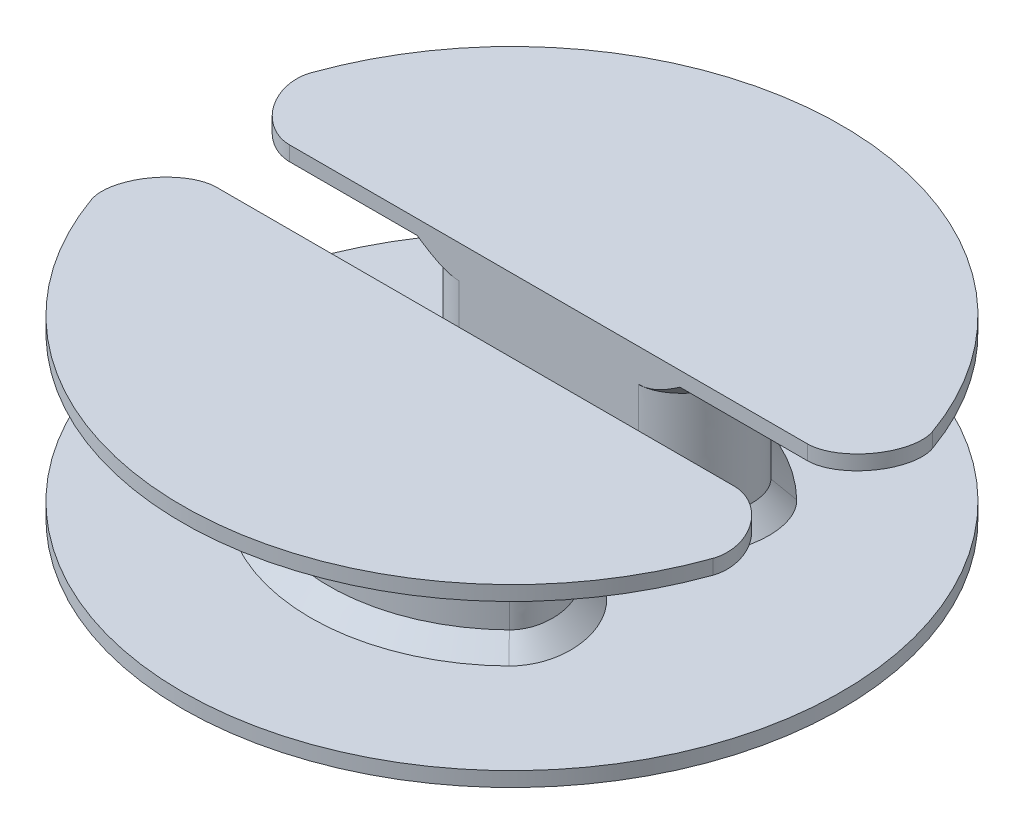
from build123d import *

# Parameters (mm, degrees)
BOSS_EXTRUDE1_DEPTH = 40
BOSS_EXTRUDE5_START = 40
BOSS_EXTRUDE5_DEPTH = 4
BOSS_EXTRUDE6_START = -4
SKETCH1_8_R         = 90
BOSS_EXTRUDE6_DEPTH = 4
CHAMFER1_SIZE       = 5


with BuildPart() as part:
    # Sketch1 → Boss-Extrude1 (new body)
    with BuildSketch(Plane(origin=(0, 0, 0), x_dir=(1, 0, 0), z_dir=(0, 1, 0))):
        with BuildLine():
            ThreePointArc((-48.989794856, -10), (0, -50), (48.989794856, -10))
            Line((48.989794856, -10), (-48.989794856, -10))
        make_face()
    extrude(amount=BOSS_EXTRUDE1_DEPTH)

    # Sketch1<7> → Boss-Extrude5 (add)
    with BuildSketch(Plane(origin=(0, 0, 0), x_dir=(1, 0, 0), z_dir=(0, 1, 0)).offset(BOSS_EXTRUDE5_START)):
        with BuildLine():
            Line((89.4427191, -10), (48.989794856, -10))
            ThreePointArc((48.989794856, -10), (0, -50), (-48.989794856, -10))
            Line((-48.989794856, -10), (-89.4427191, -10))
            ThreePointArc((-89.4427191, -10), (0, -90), (89.4427191, -10))
        make_face()
        with BuildLine():
            ThreePointArc((-48.989794856, -10), (0, -50), (48.989794856, -10))
            Line((48.989794856, -10), (-48.989794856, -10))
        make_face()
    extrude(amount=BOSS_EXTRUDE5_DEPTH)

    # Fillet2
    # a fillet whose section is not a circle: 15 mm, written as the material it takes off along each edge
    with BuildSketch(Plane(origin=(-48.989794856, -73.192505471, 10), x_dir=(1, 0, 0), z_dir=(0, 1, 0))) as fillet2_piece_1:
        with BuildLine():
            Bezier((24.494897428, 0), (-12.247448714, 0), (13.997084244, -25.714285714), weights=[1, 0.283473355, 1])
            ThreePointArc((13.997084244, -25.714285714), (5.074291573, -13.904572187), (0, 0))
            Line((0, 0), (24.494897428, 0))
        make_face()
    extrude(amount=113.192505471, mode=Mode.SUBTRACT)
    with BuildSketch(Plane(origin=(48.989794856, -73.192505471, 10), x_dir=(-1, 0, 0), z_dir=(0, 1, 0))) as fillet2_piece_2:
        with BuildLine():
            Bezier((24.494897428, 0), (-12.247448714, 0), (13.997084244, 25.714285714), weights=[1, 0.283473355, 1])
            ThreePointArc((13.997084244, 25.714285714), (5.074291573, 13.904572187), (0, 0))
            Line((0, 0), (24.494897428, 0))
        make_face()
    extrude(amount=113.192505471, mode=Mode.SUBTRACT)
    with BuildSketch(Plane(origin=(-89.4427191, -11.299806968, 10), x_dir=(0.22368043999043954, 0, 0.9746625368637513), z_dir=(0, 1, 0))) as fillet2_piece_3:
        with BuildLine():
            Bezier((20.519922787, 0), (-0.554987509, -2.418296092), (4.189991169, 18.257418584), weights=[1, 0.433012702, 1])
            Line((4.189991169, 18.257418584), (0, 0))
            ThreePointArc((0, 0), (10.259961394, -0.586728098), (20.519922787, 0))
        make_face()
    extrude(amount=106.599613936, mode=Mode.SUBTRACT)
    with BuildSketch(Plane(origin=(89.4427191, -11.299806968, 10), x_dir=(-0.22368043999043855, 0, 0.9746625368637516), z_dir=(0, 1, 0))) as fillet2_piece_4:
        with BuildLine():
            Bezier((20.519922787, 0), (-0.554987509, 2.418296092), (4.189991169, -18.257418584), weights=[1, 0.433012702, 1])
            Line((4.189991169, -18.257418584), (0, 0))
            ThreePointArc((0, 0), (10.259961394, 0.586728098), (20.519922787, 0))
        make_face()
    extrude(amount=106.599613936, mode=Mode.SUBTRACT)


with BuildPart() as body_2:
    # Mirror8: mirrored copy
    add(part.part.mirror(Plane.XY))


with BuildPart() as part_1:
    add(part.part)

    add(body_2.part)  # Boss-Extrude6 merges body 2
    # Sketch1<8> → Boss-Extrude6 (add)
    with BuildSketch(Plane(origin=(0, 0, 0), x_dir=(1, 0, 0), z_dir=(0, 1, 0)).offset(BOSS_EXTRUDE6_START)):
        with Locations(Location((0, 0, 0), (0, 0, 270))):
            Circle(SKETCH1_8_R)
    extrude(amount=BOSS_EXTRUDE6_DEPTH)

    # Chamfer1
    chamfer1_edges = [part_1.edges().sort_by_distance(p)[0] for p in [
        (0, 0, 10),
        (0, 40, 50),
        (0, 0, 50),
        (-36.699578309, 0, 20.017459895),
        (36.699578309, 0, 20.017459895),
        (36.691257885, 40, 19.99711107),
        (-36.691257885, 40, 19.99711107),
        (0, 0, -10),
        (0, 40, -50),
        (0, 0, -50),
        (36.699578309, 0, -20.017459895),
        (-36.699578309, 0, -20.017459895),
    ]]
    chamfer(chamfer1_edges, length=CHAMFER1_SIZE)


solid = part_1.part
